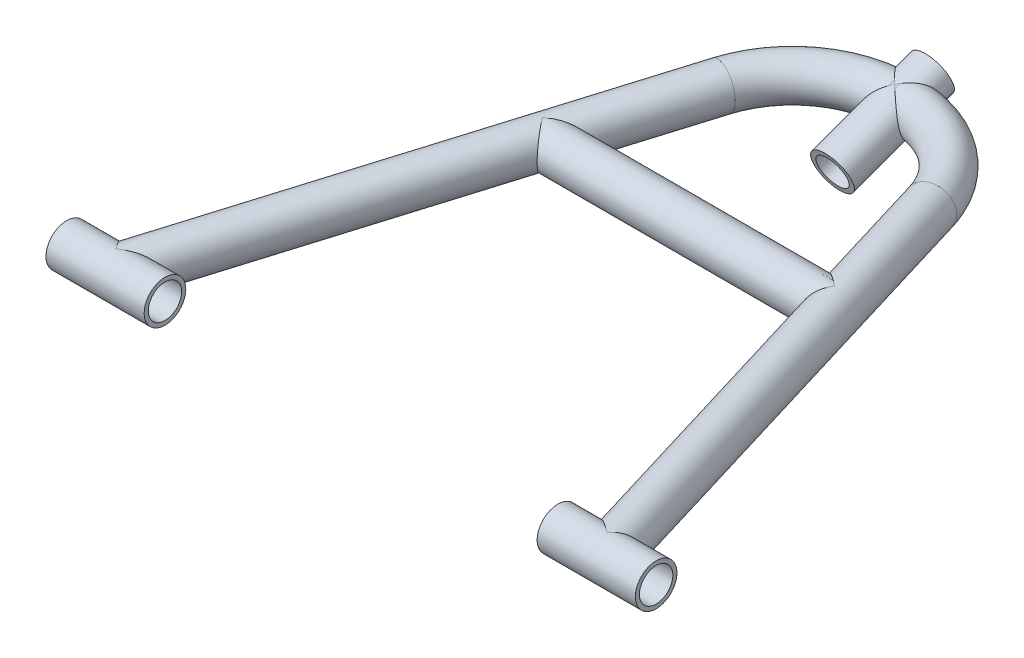
from build123d import *

# Parameters (mm, degrees)
AL_START                                       = 43.458552267
AL_ROUND_TUBING_25_4MM_OD_2_5MM_WALL_2_R       = 12.7
AL_ROUND_TUBING_25_4MM_OD_2_5MM_WALL_2_R_2     = 10.2
AL_ROUND_TUBING_25_4MM_OD_2_5MM_WALL_THI_DEPTH = 296.596909623
AL_START_2                                     = 137
AL_ROUND_TUBING_25_4MM_OD_2_5MM_WALL_3_DEPTH   = 31
AL_ROUND_TUBING_25_4MM_OD_2_5MM_WALL_4_O_R     = 12.7
AL_ROUND_TUBING_25_4MM_OD_2_5MM_WALL_4_O_R_2   = 10.2
AL_ROUND_TUBING_25_4MM_OD_2_5MM_WALL_4_ANGLE   = 73.141601
AL_START_3                                     = 298.075139191
AL_ROUND_TUBING_25_4MM_OD_2_5MM_WALL_5_O_R     = 12.7
AL_ROUND_TUBING_25_4MM_OD_2_5MM_WALL_5_O_R_2   = 10.2
AL_ROUND_TUBING_25_4MM_OD_2_5MM_WALL_5_DEPTH   = 3.556233064
AL_ROUND_TUBING_25_4MM_OD_2_5MM_WALL_6_O_R     = 12.7
AL_ROUND_TUBING_25_4MM_OD_2_5MM_WALL_6_O_R_2   = 10.2
AL_ROUND_TUBING_25_4MM_OD_2_5MM_WALL_6_ANGLE   = 73.141601
AL_START_4                                     = -166.136138572
AL_ROUND_TUBING_25_4MM_OD_2_5MM_WALL_7_O_R     = 12.7
AL_ROUND_TUBING_25_4MM_OD_2_5MM_WALL_7_O_R_2   = 10.2
AL_ROUND_TUBING_25_4MM_OD_2_5MM_WALL_7_DEPTH   = 296.596909624
AL_START_5                                     = 432
AL_ROUND_TUBING_25_4MM_OD_2_5MM_WALL_8_DEPTH   = 31
AL_START_6                                     = 210.459316229
AL_ROUND_TUBING_25_4MM_OD_2_5MM_WALL_9_O_R     = 12.7
AL_ROUND_TUBING_25_4MM_OD_2_5MM_WALL_9_O_R_2   = 10.2
AL_ROUND_TUBING_25_4MM_OD_2_5MM_WALL_9_DEPTH   = 178.787878988
AL_START_7                                     = 239
AL_ROUND_TUBING_25_4MM_OD_2_5MM_WALL_10_DEPTH  = 32
AL_START_8                                     = -97
AL_ROUND_TUBING_25_4MM_OD_2_5MM_WALL_12_DEPTH  = 32
AL_START_9                                     = 419.853255723
AL_ROUND_TUBING_25_4MM_OD_2_5MM_WALL_15_R      = 12.7
AL_ROUND_TUBING_25_4MM_OD_2_5MM_WALL_15_R_2    = 10.2
AL_ROUND_TUBING_25_4MM_OD_2_5MM_WALL_14_DEPTH  = 60
AL_START_10                                    = 119.853255723
AL_ROUND_TUBING_25_4MM_OD_2_5MM_WALL_17_R      = 12.7
AL_ROUND_TUBING_25_4MM_OD_2_5MM_WALL_17_R_2    = 10.2
AL_ROUND_TUBING_25_4MM_OD_2_5MM_WALL_16_DEPTH  = 60
SKETCH1_R                                      = 12.7
SKETCH1_R_2                                    = 9.7
AL_ROUND_TUBING_25_4MM_OD_3MM_WALL_THICK_DEPTH = 65
SKETCH115_R                                    = 9.7
CUT_EXTRUDE1_DEPTH                             = 82
SKETCH117_R                                    = 12.7
CUT_EXTRUDE3_DEPTH                             = 82


with BuildPart() as part:
    # Al round tubing 25.4MM_OD_2.5MM_WALL_THICKNESS(1): read off the stored shape, not the designer's step
    # Al round tubing 25.4MM_OD_2.5MM_WALL 2 → Al round tubing 25.4MM_OD_2.5MM_WALL_THICKNESS(1) (new body)
    with BuildSketch(Plane(origin=(0, 0, 0), x_dir=(0.9570244044334734, 0, 0.2900073952828711), z_dir=(0.2900073952828711, 0, -0.9570244044334735)).offset(AL_START)):
        with Locations((143.41322281, 0)):
            Circle(AL_ROUND_TUBING_25_4MM_OD_2_5MM_WALL_2_R)
        with Locations((143.41322281, 0)):
            Circle(AL_ROUND_TUBING_25_4MM_OD_2_5MM_WALL_2_R_2, mode=Mode.SUBTRACT)
    extrude(amount=AL_ROUND_TUBING_25_4MM_OD_2_5MM_WALL_THI_DEPTH)

    # Al round tubing 25.4MM_OD_2.5MM_WALL 3 o → Al round tubing 25.4MM_OD_2.5MM_WALL 3 (cut)
    with BuildSketch(Plane.YZ.offset(AL_START_2)):
        with BuildLine():
            ThreePointArc((-12.7, 0), (0, -12.7), (12.7, 0))
            Line((12.7, 0), (12.7, 5))
            Line((12.7, 5), (-12.7, 5))
            Line((-12.7, 5), (-12.7, 0))
        make_face()
    extrude(amount=AL_ROUND_TUBING_25_4MM_OD_2_5MM_WALL_3_DEPTH, mode=Mode.SUBTRACT)


with BuildPart() as body_2:
    # Al round tubing 25.4MM_OD_2.5MM_WALL 4 o → Al round tubing 25.4MM_OD_2.5MM_WALL 4 (revolve)
    with BuildSketch(Plane(origin=(298.075139191, 0, -265), x_dir=(0, 0, -1), z_dir=(1, 0, 0))):
        with Locations((65, 0)):
            Circle(AL_ROUND_TUBING_25_4MM_OD_2_5MM_WALL_4_O_R)
        with Locations((65, 0)):
            Circle(AL_ROUND_TUBING_25_4MM_OD_2_5MM_WALL_4_O_R_2, mode=Mode.SUBTRACT)
    revolve(axis=Axis((298.075139191, 0, -265), (0, 1, 0)), revolution_arc=AL_ROUND_TUBING_25_4MM_OD_2_5MM_WALL_4_ANGLE)


with BuildPart() as body_3:
    # Al round tubing 25.4MM_OD_2.5MM_WALL 5 o → Al round tubing 25.4MM_OD_2.5MM_WALL 5 (new body)
    with BuildSketch(Plane.YZ.offset(AL_START_3)):
        with Locations((0, -330)):
            Circle(AL_ROUND_TUBING_25_4MM_OD_2_5MM_WALL_5_O_R)
        with Locations((0, -330)):
            Circle(AL_ROUND_TUBING_25_4MM_OD_2_5MM_WALL_5_O_R_2, mode=Mode.SUBTRACT)
    extrude(amount=AL_ROUND_TUBING_25_4MM_OD_2_5MM_WALL_5_DEPTH)


with BuildPart() as body_4:
    # Al round tubing 25.4MM_OD_2.5MM_WALL 6 o → Al round tubing 25.4MM_OD_2.5MM_WALL 6 (revolve)
    with BuildSketch(Plane(origin=(301.631372255, 0, -265), x_dir=(0.9570244044334763, 0, -0.290007395282862), z_dir=(0.290007395282862, 0, 0.9570244044334763))):
        with Locations((65, 0)):
            Circle(AL_ROUND_TUBING_25_4MM_OD_2_5MM_WALL_6_O_R)
        with Locations((65, 0)):
            Circle(AL_ROUND_TUBING_25_4MM_OD_2_5MM_WALL_6_O_R_2, mode=Mode.SUBTRACT)
    revolve(axis=Axis((301.631372255, 0, -265), (0, 1, 0)), revolution_arc=AL_ROUND_TUBING_25_4MM_OD_2_5MM_WALL_6_ANGLE)


with BuildPart() as body_5:
    # Al round tubing 25.4MM_OD_2.5MM_WALL 7 o → Al round tubing 25.4MM_OD_2.5MM_WALL 7 (new body)
    with BuildSketch(Plane(origin=(0, 0, 0), x_dir=(0.9570244044334735, 0, -0.29000739528287095), z_dir=(0.2900073952828709, 0, 0.9570244044334736)).offset(AL_START_4)):
        with Locations((430.52054414, 0)):
            Circle(AL_ROUND_TUBING_25_4MM_OD_2_5MM_WALL_7_O_R)
        with Locations((430.52054414, 0)):
            Circle(AL_ROUND_TUBING_25_4MM_OD_2_5MM_WALL_7_O_R_2, mode=Mode.SUBTRACT)
    extrude(amount=AL_ROUND_TUBING_25_4MM_OD_2_5MM_WALL_7_DEPTH)

    # Al round tubing 25.4MM_OD_2.5MM_WALL 8 o → Al round tubing 25.4MM_OD_2.5MM_WALL 8 (cut)
    with BuildSketch(Plane.YZ.offset(AL_START_5)):
        with BuildLine():
            ThreePointArc((-12.7, 0), (0, -12.7), (12.7, 0))
            Line((12.7, 0), (12.7, 5))
            Line((12.7, 5), (-12.7, 5))
            Line((-12.7, 5), (-12.7, 0))
        make_face()
    extrude(amount=AL_ROUND_TUBING_25_4MM_OD_2_5MM_WALL_8_DEPTH, mode=Mode.SUBTRACT)


with BuildPart() as body_6:
    # Al round tubing 25.4MM_OD_2.5MM_WALL 9 o → Al round tubing 25.4MM_OD_2.5MM_WALL 9 (new body)
    with BuildSketch(Plane.YZ.offset(AL_START_6)):
        with Locations((0, -200)):
            Circle(AL_ROUND_TUBING_25_4MM_OD_2_5MM_WALL_9_O_R)
        with Locations((0, -200)):
            Circle(AL_ROUND_TUBING_25_4MM_OD_2_5MM_WALL_9_O_R_2, mode=Mode.SUBTRACT)
    extrude(amount=AL_ROUND_TUBING_25_4MM_OD_2_5MM_WALL_9_DEPTH)

    # Al round tubing 25.4MM_OD_2.5MM_WALL 11 → Al round tubing 25.4MM_OD_2.5MM_WALL 10 (cut)
    with BuildSketch(Plane(origin=(0, 0, 0), x_dir=(0.9570244044334734, 0, 0.2900073952828711), z_dir=(0.2900073952828711, 0, -0.9570244044334735)).offset(AL_START_7)):
        with BuildLine():
            ThreePointArc((143.41322281, -12.7), (156.11322281, 0), (143.41322281, 12.7))
            Line((143.41322281, 12.7), (138, 12.7))
            Line((138, 12.7), (138, -12.7))
            Line((138, -12.7), (143.41322281, -12.7))
        make_face()
    extrude(amount=AL_ROUND_TUBING_25_4MM_OD_2_5MM_WALL_10_DEPTH, mode=Mode.SUBTRACT)

    # Al round tubing 25.4MM_OD_2.5MM_WALL 13 → Al round tubing 25.4MM_OD_2.5MM_WALL 12 (cut)
    with BuildSketch(Plane(origin=(0, 0, 0), x_dir=(0.9570244044334735, 0, -0.29000739528287095), z_dir=(0.2900073952828709, 0, 0.9570244044334736)).offset(AL_START_8)):
        with BuildLine():
            ThreePointArc((430.52054414, 12.7), (417.82054414, 0), (430.52054414, -12.7))
            Line((430.52054414, -12.7), (436, -12.7))
            Line((436, -12.7), (436, 12.7))
            Line((436, 12.7), (430.52054414, 12.7))
        make_face()
    extrude(amount=AL_ROUND_TUBING_25_4MM_OD_2_5MM_WALL_12_DEPTH, mode=Mode.SUBTRACT)


with BuildPart() as body_7:
    # Al round tubing 25.4MM_OD_2.5MM_WALL 15 → Al round tubing 25.4MM_OD_2.5MM_WALL 14 (new body)
    with BuildSketch(Plane.YZ.offset(AL_START_9)):
        Circle(AL_ROUND_TUBING_25_4MM_OD_2_5MM_WALL_15_R)
        Circle(AL_ROUND_TUBING_25_4MM_OD_2_5MM_WALL_15_R_2, mode=Mode.SUBTRACT)
    extrude(amount=AL_ROUND_TUBING_25_4MM_OD_2_5MM_WALL_14_DEPTH)


with BuildPart() as body_8:
    # Al round tubing 25.4MM_OD_2.5MM_WALL 17 → Al round tubing 25.4MM_OD_2.5MM_WALL 16 (new body)
    with BuildSketch(Plane.YZ.offset(AL_START_10)):
        Circle(AL_ROUND_TUBING_25_4MM_OD_2_5MM_WALL_17_R)
        Circle(AL_ROUND_TUBING_25_4MM_OD_2_5MM_WALL_17_R_2, mode=Mode.SUBTRACT)
    extrude(amount=AL_ROUND_TUBING_25_4MM_OD_2_5MM_WALL_16_DEPTH)


with BuildPart() as body_9:
    # Sketch1 → Al round tubing 25.4MM_OD_3MM_WALL_THICKNESS(1) (new body)
    with BuildSketch(Plane(origin=(299.853255723, 6.857060038, -348.787781339), x_dir=(1, 0, 0), z_dir=(6.8321416900009675e-15, -0.34285300192345736, 0.9393890669323728))):
        Circle(SKETCH1_R)
        Circle(SKETCH1_R_2, mode=Mode.SUBTRACT)
    extrude(amount=AL_ROUND_TUBING_25_4MM_OD_3MM_WALL_THICK_DEPTH)


with BuildPart() as cut_extrude1_tool:
    # Sketch115 → Cut-Extrude1 (new body)
    with BuildSketch(Plane(origin=(0, 113.140939357, -309.996881632), x_dir=(-1, 0, 0), z_dir=(-6.83214169000097e-15, 0.34285300192345747, -0.9393890669323727))):
        with Locations(Location((-299.853255723, -113.141490635, 0), (0, 0, 270))):
            Circle(SKETCH115_R)
    extrude(amount=-CUT_EXTRUDE1_DEPTH)


with BuildPart() as body_2_1:
    add(body_2.part)

    # Cut-Extrude1: cut by cut_extrude1_tool
    add(cut_extrude1_tool.part, mode=Mode.SUBTRACT)


with BuildPart() as body_3_1:
    add(body_3.part)

    # Cut-Extrude1: cut by cut_extrude1_tool
    add(cut_extrude1_tool.part, mode=Mode.SUBTRACT)


with BuildPart() as body_4_1:
    add(body_4.part)

    # Cut-Extrude1: cut by cut_extrude1_tool
    add(cut_extrude1_tool.part, mode=Mode.SUBTRACT)


with BuildPart() as cut_extrude3_tool:
    # Sketch117 → Cut-Extrude3 (new body)
    with BuildSketch(Plane(origin=(0, 113.140939357, -309.996881632), x_dir=(-1, 0, 0), z_dir=(-6.83214169000097e-15, 0.34285300192345747, -0.9393890669323727))):
        with Locations(Location((-299.853255723, -113.141490635, 0), (0, 0, 270))):
            Circle(SKETCH117_R)
    extrude(amount=-CUT_EXTRUDE3_DEPTH)


with BuildPart() as body_2_2:
    add(body_2_1.part)

    # Cut-Extrude3: cut by cut_extrude3_tool
    add(cut_extrude3_tool.part, mode=Mode.SUBTRACT)


with BuildPart() as body_4_2:
    add(body_4_1.part)

    # Cut-Extrude3: cut by cut_extrude3_tool
    add(cut_extrude3_tool.part, mode=Mode.SUBTRACT)


solid = Compound([part.part, body_5.part, body_6.part, body_7.part, body_8.part, body_9.part, body_3_1.part, body_2_2.part, body_4_2.part])
